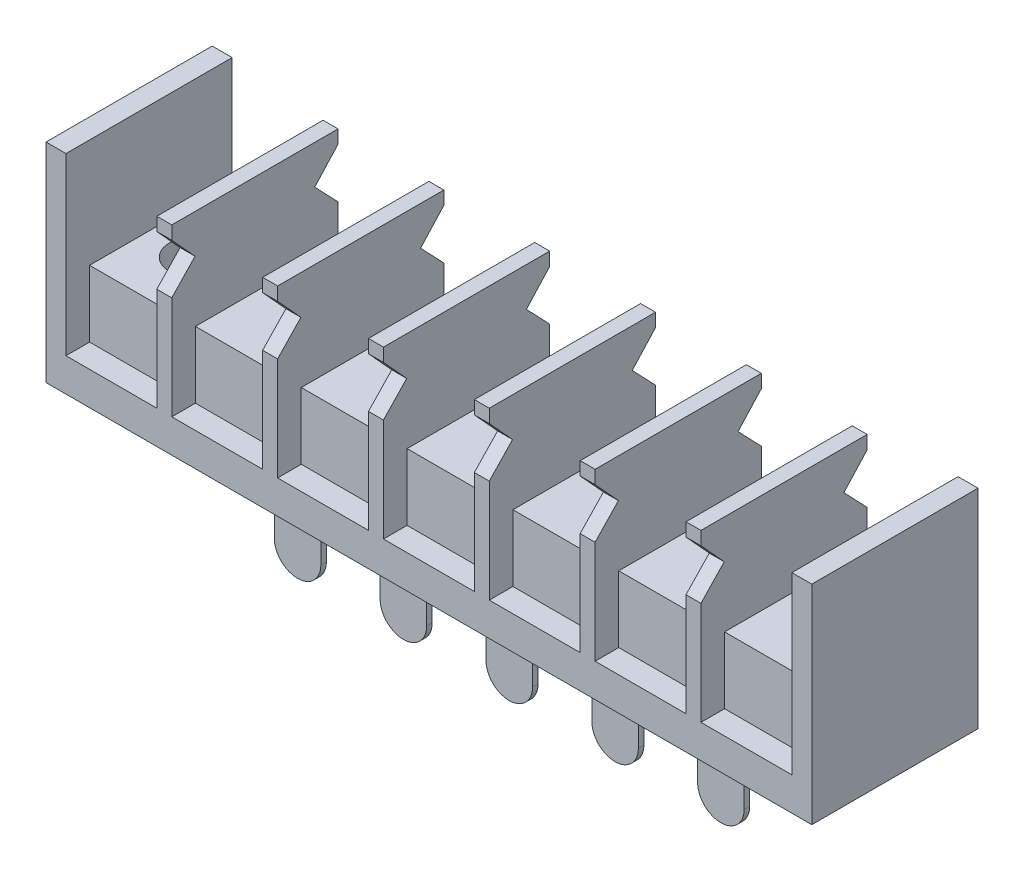
from build123d import *

# Parameters (mm, degrees)
SKETCH_1_W          = 69.1
SKETCH_1_H          = 15
EXTRUDE_1_DEPTH     = 18.8
SKETCH_2_W          = 65.5
SKETCH_2_H          = 15
CUT_EXTRUDE_1_DEPTH = 0.8
SKETCH_4_W          = 8.2
SKETCH_4_H          = 15
CUT_EXTRUDE_2_DEPTH = 9
SKETCH_5_W          = 8.2
SKETCH_5_H          = 2.132429546
CUT_EXTRUDE_3_DEPTH = 15
SKETCH_6_W          = 4.2
SKETCH_6_H          = 0.5
EXTRUDE_2_DEPTH     = 11.2
SKETCH_7_R          = 2.25
CUT_EXTRUDE_4_DEPTH = 41.718454047
CUT_EXTRUDE_START   = -49.1
CUT_EXTRUDE_5_DEPTH = 49.1
FILLET_1_R          = 2.1


with BuildPart() as part:
    # 草图1 → 拉伸1 (new body)
    with BuildSketch(Plane(origin=(0, 0, 0), x_dir=(1, 0, 0), z_dir=(0, 1, 0))):
        Rectangle(SKETCH_1_W, SKETCH_1_H)
    extrude(amount=EXTRUDE_1_DEPTH)

    # 草图2 → 切除-拉伸1 (cut)
    with BuildSketch(Plane(origin=(0, 18.8, 0), x_dir=(-1, 0, 0), z_dir=(0, 1, 0))):
        Rectangle(SKETCH_2_W, SKETCH_2_H)
    extrude(amount=-CUT_EXTRUDE_1_DEPTH, mode=Mode.SUBTRACT)

    # 草图4 → 切除-拉伸2 (cut)
    with BuildSketch(Plane(origin=(0, 18, 0), x_dir=(-1, 0, 0), z_dir=(0, 1, 0))):
        with Locations((-28.65, 0)):
            Rectangle(SKETCH_4_W, SKETCH_4_H)
        with Locations((-19.1, 0)):
            Rectangle(SKETCH_4_W, SKETCH_4_H)
        with Locations((-9.55, 0)):
            Rectangle(SKETCH_4_W, SKETCH_4_H)
        Rectangle(SKETCH_4_W, SKETCH_4_H)
        with Locations((9.55, 0)):
            Rectangle(SKETCH_4_W, SKETCH_4_H)
        with Locations((19.1, 0)):
            Rectangle(SKETCH_4_W, SKETCH_4_H)
        with Locations((28.65, 0)):
            Rectangle(SKETCH_4_W, SKETCH_4_H)
    extrude(amount=-CUT_EXTRUDE_2_DEPTH, mode=Mode.SUBTRACT)

    # 草图5 → 切除-拉伸3 (cut)
    with BuildSketch(Plane(origin=(0, 18, 0), x_dir=(-1, 0, 0), z_dir=(0, 1, 0))):
        with Locations((-28.65, -6.433785227)):
            Rectangle(SKETCH_5_W, SKETCH_5_H)
        with Locations((-28.65, 6.433785227)):
            Rectangle(SKETCH_5_W, SKETCH_5_H)
        with Locations((-19.1, -6.433785227)):
            Rectangle(SKETCH_5_W, SKETCH_5_H)
        with Locations((-19.1, 6.433785227)):
            Rectangle(SKETCH_5_W, SKETCH_5_H)
        with Locations((-9.55, -6.433785227)):
            Rectangle(SKETCH_5_W, SKETCH_5_H)
        with Locations((-9.55, 6.433785227)):
            Rectangle(SKETCH_5_W, SKETCH_5_H)
        with Locations((0, -6.433785227)):
            Rectangle(SKETCH_5_W, SKETCH_5_H)
        with Locations((0, 6.433785227)):
            Rectangle(SKETCH_5_W, SKETCH_5_H)
        with Locations((9.55, -6.433785227)):
            Rectangle(SKETCH_5_W, SKETCH_5_H)
        with Locations((9.55, 6.433785227)):
            Rectangle(SKETCH_5_W, SKETCH_5_H)
        with Locations((19.1, -6.433785227)):
            Rectangle(SKETCH_5_W, SKETCH_5_H)
        with Locations((19.1, 6.433785227)):
            Rectangle(SKETCH_5_W, SKETCH_5_H)
        with Locations((28.65, -6.433785227)):
            Rectangle(SKETCH_5_W, SKETCH_5_H)
        with Locations((28.65, 6.433785227)):
            Rectangle(SKETCH_5_W, SKETCH_5_H)
    extrude(amount=-CUT_EXTRUDE_3_DEPTH, mode=Mode.SUBTRACT)

    # 草图6 → 拉伸2 (add)
    with BuildSketch(Plane.XZ):
        Rectangle(SKETCH_6_W, SKETCH_6_H)
        with Locations((9.55, 0)):
            Rectangle(SKETCH_6_W, SKETCH_6_H)
        with Locations((19.1, 0)):
            Rectangle(SKETCH_6_W, SKETCH_6_H)
        with Locations((-9.55, 0)):
            Rectangle(SKETCH_6_W, SKETCH_6_H)
        with Locations((-19.1, 0)):
            Rectangle(SKETCH_6_W, SKETCH_6_H)
    extrude(amount=EXTRUDE_2_DEPTH)

    # 草图7 → 切除-拉伸4 (cut, through all)
    with BuildSketch(Plane(origin=(0, 9, 0), x_dir=(-1, 0, 0), z_dir=(0, 1, 0))):
        with Locations(Location((-28.65, 0, 0), (0, 0, 90))):
            Circle(SKETCH_7_R)
        with Locations(Location((28.65, 0, 0), (0, 0, 270))):
            Circle(SKETCH_7_R)
    extrude(amount=-CUT_EXTRUDE_4_DEPTH, mode=Mode.SUBTRACT)

    # 草图8 → 切除-拉伸5 (cut)
    with BuildSketch(Plane(origin=(24.55, 0, 0), x_dir=(0, 0, -1), z_dir=(1, 0, 0)).offset(CUT_EXTRUDE_START)):
        Polygon((7.5, 16.8), (5.4, 14.5), (7.5, 12.3), align=None)
        Polygon((-7.5, 16.8), (-7.5, 12.3), (-5.4, 14.5), align=None)
    extrude(amount=CUT_EXTRUDE_5_DEPTH, mode=Mode.SUBTRACT)

    # 圆角1
    fillet_1_edges = [part.edges().sort_by_distance(p)[0] for p in [
        (-21.2, -11.2, 0),
        (21.2, -11.2, 0),
        (17, -11.2, 0),
        (11.65, -11.2, 0),
        (7.45, -11.2, 0),
        (-2.1, -11.2, 0),
        (2.1, -11.2, 0),
        (-7.45, -11.2, 0),
        (-11.65, -11.2, 0),
        (-17, -11.2, 0),
    ]]
    fillet(fillet_1_edges, radius=FILLET_1_R - 0.0001)  # a hair under: the kernel refuses the full size


solid = part.part
